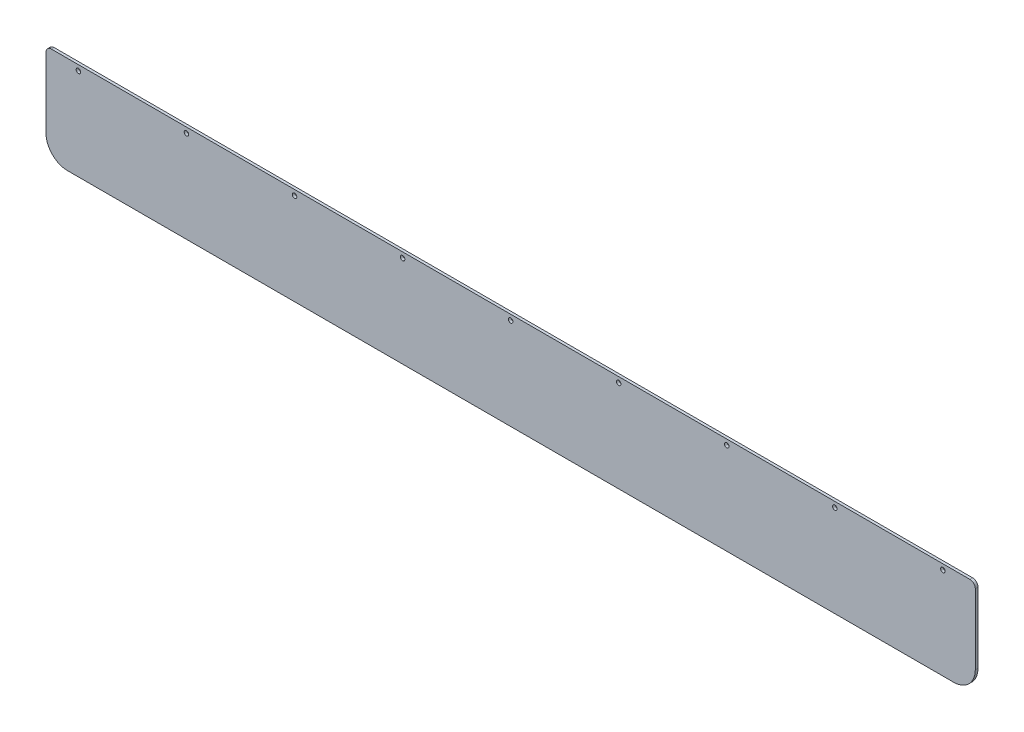
from build123d import *

# Parameters (mm, degrees)
SKETCH1_W          = 2184.4
SKETCH1_H          = 6.35
BASE_FLANGE1_DEPTH = 228.6
SKETCH2_R          = 5.3578125
CUT_EXTRUDE1_DEPTH = 6.35
FILLET1_R          = 50.8
FILLET2_R          = 12.7


# Sheet-metal steps are written as plain solids
with BuildPart() as part:
    # Sketch1 → Base-Flange1 (new body)
    with BuildSketch(Plane(origin=(0, 0, 0), x_dir=(1, 0, 0), z_dir=(0, 1, 0))):
        with Locations((1168.4, -66.675)):
            Rectangle(SKETCH1_W, SKETCH1_H)
    extrude(amount=BASE_FLANGE1_DEPTH)

    # Sketch2 → Cut-Extrude1 (cut)
    with BuildSketch(Plane.XY.offset(69.85)):
        with Locations((152.4, 215.9)):
            Circle(SKETCH2_R)
        with Locations((406.4, 215.9)):
            Circle(SKETCH2_R)
        with Locations((660.4, 215.9)):
            Circle(SKETCH2_R)
        with Locations((914.4, 215.9)):
            Circle(SKETCH2_R)
        with Locations((1168.4, 215.9)):
            Circle(SKETCH2_R)
        with Locations((1422.4, 215.9)):
            Circle(SKETCH2_R)
        with Locations((1676.4, 215.9)):
            Circle(SKETCH2_R)
        with Locations((1930.4, 215.9)):
            Circle(SKETCH2_R)
        with Locations((2184.4, 215.9)):
            Circle(SKETCH2_R)
    extrude(amount=-CUT_EXTRUDE1_DEPTH, mode=Mode.SUBTRACT)

    # Fillet1
    fillet1_edges = [part.edges().sort_by_distance(p)[0] for p in [
        (2260.6, 0, 66.675),
        (76.2, 0, 66.675),
    ]]
    fillet(fillet1_edges, radius=FILLET1_R)

    # Fillet2
    fillet2_edges = [part.edges().sort_by_distance(p)[0] for p in [
        (2260.6, 228.6, 66.675),
        (76.2, 228.6, 66.675),
    ]]
    fillet(fillet2_edges, radius=FILLET2_R)


solid = part.part
